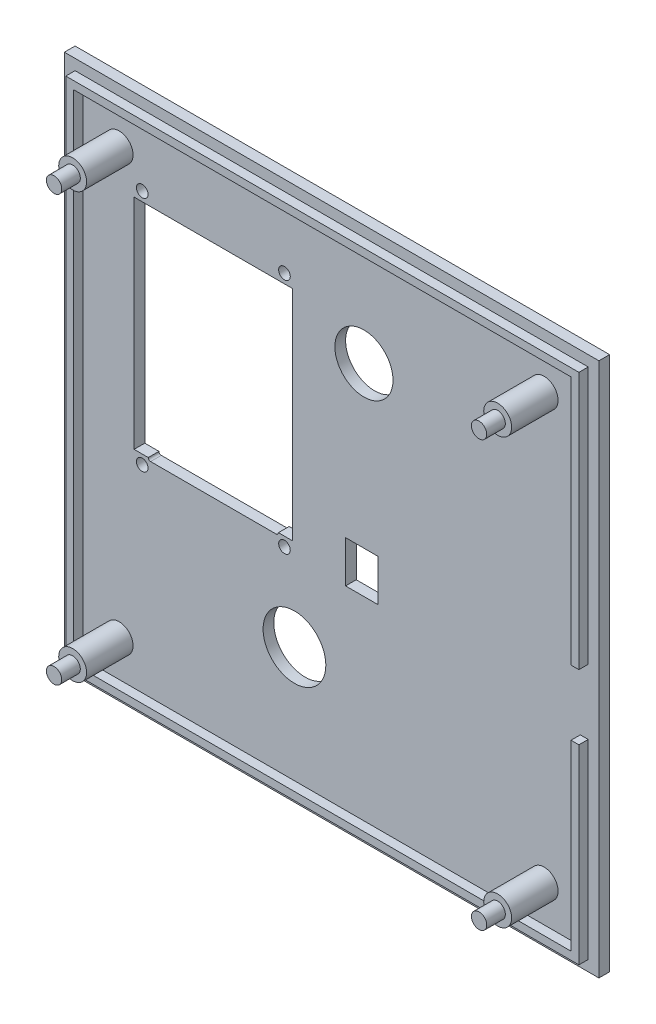
from build123d import *

# Parameters (mm, degrees)
SKETCH1_W               = 110.4
SKETCH1_H               = 110.4
SKETCH1_W_2             = 107
SKETCH1_H_2             = 107
BOSS_EXTRUDE1_DEPTH     = 2
SKETCH3_W               = 115
SKETCH3_H               = 115
BOSS_EXTRUDE2_DEPTH     = 2.3
SKETCH4_R               = 3
BOSS_EXTRUDE3_DEPTH     = 10
CUT_EXTRUDE2_DEPTH      = 82.929848041
CUT_EXTRUDE2_DEPTH_BACK = 82.929848041
SKETCH5_R               = 6.75
SKETCH5_R_2             = 6.25
SKETCH5_R_3             = 1.25
SKETCH5_W               = 7
SKETCH5_H               = 9
SKETCH5_W_2             = 34.1
SKETCH5_H_2             = 47
SKETCH5_W_3             = 28
SKETCH5_H_3             = 1
SKETCH6_R               = 1.65
BOSS_EXTRUDE4_DEPTH     = 4
SKETCH7_W               = 24.147095738
SKETCH7_H               = 14
CUT_EXTRUDE4_DEPTH      = 10
FILLET1_R               = 0.5


with BuildPart() as part:
    # Sketch1 → Boss-Extrude1 (new body)
    with BuildSketch(Plane.XY):
        Rectangle(SKETCH1_W, SKETCH1_H)
        Rectangle(SKETCH1_W_2, SKETCH1_H_2, mode=Mode.SUBTRACT)
    extrude(amount=BOSS_EXTRUDE1_DEPTH)

    # Sketch3 → Boss-Extrude2 (add)
    with BuildSketch(Plane(origin=(0, 0, 0), x_dir=(-1, 0, 0), z_dir=(0, 0, -1))):
        Rectangle(SKETCH3_W, SKETCH3_H)
    extrude(amount=BOSS_EXTRUDE2_DEPTH)

    # Sketch4 → Boss-Extrude3 (add)
    with BuildSketch(Plane.XY):
        with Locations(Location((-45.72, 45.72, 0), (0, 0, 180))):
            Circle(SKETCH4_R)
        with Locations(Location((45.72, 45.72, 0), (0, 0, 180))):
            Circle(SKETCH4_R)
        with Locations(Location((45.72, -45.72, 0), (0, 0, 180))):
            Circle(SKETCH4_R)
        with Locations(Location((-45.72, -45.72, 0), (0, 0, 180))):
            Circle(SKETCH4_R)
    extrude(amount=BOSS_EXTRUDE3_DEPTH)

    # Sketch5 → Cut-Extrude2 (cut, two sides: drawn at the far end of the back side and taken through both)
    with BuildSketch(Plane.XY.offset(-CUT_EXTRUDE2_DEPTH_BACK)):
        with Locations((-8, -28.6)):
            Circle(SKETCH5_R)
        with Locations((6.95, 31.72)):
            Circle(SKETCH5_R_2)
        with Locations((-40.75, -11)):
            Circle(SKETCH5_R_3)
        with Locations((-10.15, -11)):
            Circle(SKETCH5_R_3)
        with Locations((-10.15, 40)):
            Circle(SKETCH5_R_3)
        with Locations((-40.75, 40)):
            Circle(SKETCH5_R_3)
        with Locations((6.5, -7.2)):
            Rectangle(SKETCH5_W, SKETCH5_H)
        with Locations((-25.45, 14.5)):
            Rectangle(SKETCH5_W_2, SKETCH5_H_2)
        with Locations((-25.45, -9)):
            Rectangle(SKETCH5_W_3, SKETCH5_H_3)
    extrude(amount=CUT_EXTRUDE2_DEPTH + CUT_EXTRUDE2_DEPTH_BACK, mode=Mode.SUBTRACT)

    # Sketch6 → Boss-Extrude4 (add)
    with BuildSketch(Plane.XY.offset(10)):
        with Locations((-45.72, 45.72)):
            Circle(SKETCH6_R)
        with Locations((45.72, 45.72)):
            Circle(SKETCH6_R)
        with Locations((45.72, -45.72)):
            Circle(SKETCH6_R)
        with Locations((-45.72, -45.72)):
            Circle(SKETCH6_R)
    extrude(amount=BOSS_EXTRUDE4_DEPTH)

    # Sketch7 → Cut-Extrude4 (cut)
    with BuildSketch(Plane.XY):
        with Locations((57.5, -7.2)):
            Rectangle(SKETCH7_W, SKETCH7_H)
    extrude(amount=CUT_EXTRUDE4_DEPTH, mode=Mode.SUBTRACT)

    # Fillet1
    fillet1_edges = [part.edges().sort_by_distance(p)[0] for p in [
        (-11.45, -9.5, -1.15),
        (-39.45, -9.5, -1.15),
    ]]
    fillet(fillet1_edges, radius=FILLET1_R - 0.0001)  # a hair under: the kernel refuses the full size


solid = part.part
